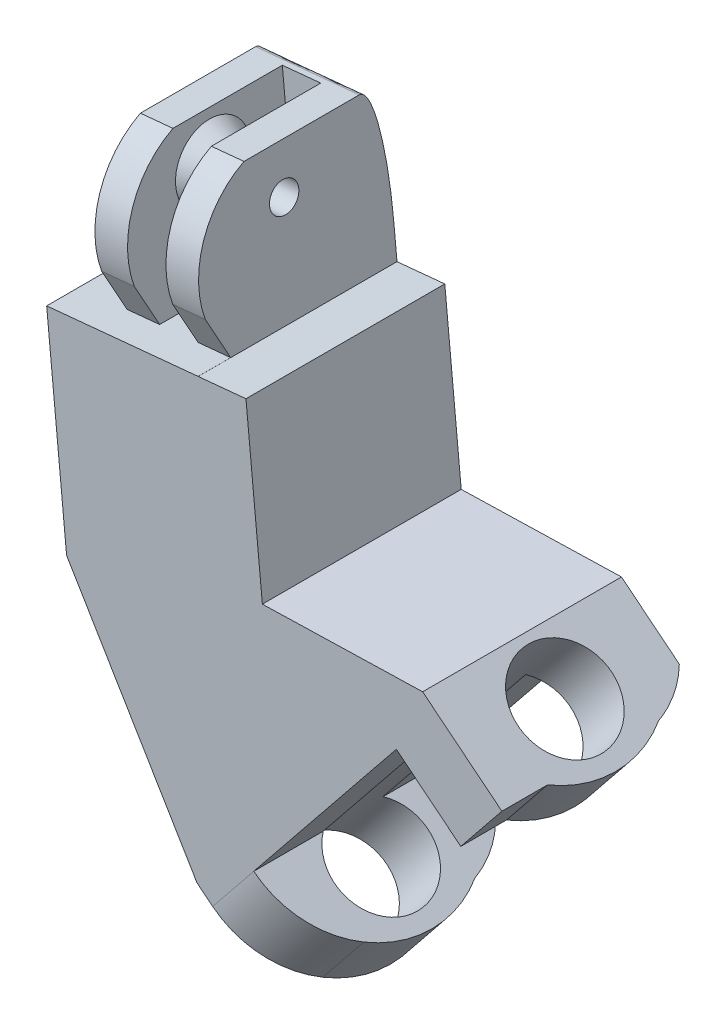
from build123d import *

# Parameters (mm, degrees)
BOSS_EXTRUDE1_DEPTH     = 17
CUT_EXTRUDE1_DEPTH      = 15
CUT_EXTRUDE2_DEPTH      = 46.197309304
CUT_EXTRUDE2_DEPTH_BACK = 46.197309304
CUT_EXTRUDE3_DEPTH      = 12
SKETCH6_R               = 4
CUT_EXTRUDE4_DEPTH      = 35
CUT_EXTRUDE5_START      = -12.78511231
CUT_EXTRUDE5_OUTLINE_W  = 3.3
CUT_EXTRUDE5_OUTLINE_H  = 13.870481222
CUT_EXTRUDE5_DEPTH      = 12.78511231
SKETCH8_R               = 1.25
CUT_EXTRUDE6_DEPTH      = 15
SKETCH10_R              = 1.25
CUT_EXTRUDE7_DEPTH      = 15
FILLET1_SIZE            = 2
FILLET1_SIZE_2          = 10


# Read off the part's stored shape, not the designer's step: Cut-Extrude5, Extrude-Thin1
with BuildPart() as part:
    # Sketch1 → Boss-Extrude1 (new body)
    with BuildSketch(Plane.XY):
        Polygon((-9.564728379, 17.62000192), (-5.473819301, 18.015682238), (-6.704675095, 30.741407789), (2.153984466, 31.598233783), (3.38531081, 18.867643246), (7.473335954, 19.262913811), (8.876277245, 4.753208867), (22.578615379, 5.119591375), (30.743737203, -1.458779689), (27.230396467, -5.819563663), (20.33101325, -0.260956714), (8.140408694, -15.392023407), (15.036201119, -20.947737373), (11.522860383, -25.308521347), (3.283942394, -18.670695131), (-7.860727511, 0), align=None)
    extrude(amount=BOSS_EXTRUDE1_DEPTH)

    # Sketch3 → Cut-Extrude1 (cut)
    with BuildSketch(Plane(origin=(-3.696725775, -0.357554178, 0), x_dir=(0, 0, 1), z_dir=(-0.9953550068413657, -0.09627258361457379, 0))):
        with BuildLine():
            Line((0, 31.244090554), (0, 32.721435634))
            Line((0, 32.721435634), (17.68, 32.721435634))
            Line((17.68, 32.721435634), (17.68, 18.458978244))
            Line((17.68, 18.458978244), (14.22, 18.458978244))
            Line((14.22, 18.458978244), (16.043166109, 22.04177957))
            ThreePointArc((16.043166109, 22.04177957), (15.680947079, 27.433223117), (11.85, 31.244090554))
            Line((11.85, 31.244090554), (0, 31.244090554))
        make_face()
    extrude(amount=-CUT_EXTRUDE1_DEPTH, mode=Mode.SUBTRACT)

    # Sketch4 → Cut-Extrude2 (cut, two sides: drawn at the far end of the back side and taken through both)
    with BuildSketch(Plane(origin=(7.87496966, 9.774469394, 0), x_dir=(0.7787114240648987, -0.6273822742402098, 0), z_dir=(-0.6273822742402096, -0.7787114240648986, 0)).offset(-CUT_EXTRUDE2_DEPTH_BACK)):
        Polygon((15.990906633, 19.904885529), (15.990906633, 16.999999998), (15.995711897, 16.999999998), (23.069210216, 16.999999998), (24.855711897, 17), (24.855711897, 0), (20.721010741, 0), (15.995711897, -2e-09), (15.990906633, -2e-09), (15.990906633, -2.308790515), (29.141254547, -2.308790515), (29.141254547, 19.904885529), align=None)
        with BuildLine():
            Line((24.855711897, 17), (23.069210216, 17))
            Line((23.069210216, 16.999999998), (23.069210216, 13.096000073))
            ThreePointArc((23.069210216, 13.096000073), (24.441573822, 8.347001118), (23.069216362, 3.598000386))
            add(Edge.make_bspline(
                [(20.721010741, -2e-09), (22.390075827, 1.367964254), (23.069216362, 3.598000386)],
                knots=[0, 0, 0, 1, 1, 1], degree=2))
            Line((20.721010741, 0), (24.855711897, 0))
            Line((24.855711897, 0), (24.855711897, 17))
        make_face()
    extrude(amount=CUT_EXTRUDE2_DEPTH + CUT_EXTRUDE2_DEPTH_BACK, mode=Mode.SUBTRACT)

    # Sketch5 → Cut-Extrude3 (cut)
    with BuildSketch(Plane(origin=(-4.315634896, -5.356597299, 0), x_dir=(0.7787114240649037, -0.6273822742402033, 0), z_dir=(0.6273822742402033, 0.7787114240649037, 0))):
        with BuildLine():
            Line((15.990245326, -16.999999999), (23.069210216, -16.999999999))
            Line((23.069210216, -16.999999999), (23.069210216, -13.096000073))
            ThreePointArc((23.069210216, -13.096000073), (20.032304179, -15.959301473), (15.990245326, -16.999999999))
        make_face()
    extrude(amount=-CUT_EXTRUDE3_DEPTH, mode=Mode.SUBTRACT)

    # Sketch6 → Cut-Extrude4 (cut)
    with BuildSketch(Plane(origin=(11.388310395, 14.135253369, 0), x_dir=(0.7787114240649039, -0.6273822742402033, 0), z_dir=(0.6273822742402032, 0.7787114240649039, 0))):
        with Locations(Location((19.069210216, -8.499999999, 0), (0, 0, 180))):
            Circle(SKETCH6_R)
    extrude(amount=-CUT_EXTRUDE4_DEPTH, mode=Mode.SUBTRACT)

    # Cut-Extrude5 outline → Cut-Extrude5 (cut)
    with BuildSketch(Plane(origin=(-3.00794932, 31.098961967, 0), x_dir=(0.995355006841366, 0.0962725836145697, 0), z_dir=(-0.0962725836145697, 0.995355006841366, 0)).offset(CUT_EXTRUDE5_START)):
        with Locations((0.736022827, -9.435240611)):
            Rectangle(CUT_EXTRUDE5_OUTLINE_W, CUT_EXTRUDE5_OUTLINE_H)
    extrude(amount=CUT_EXTRUDE5_DEPTH, mode=Mode.SUBTRACT)

    # Sketch8 → Cut-Extrude6 (cut)
    with BuildSketch(Plane(origin=(5.161933786, 0.499271816, 0), x_dir=(0, 0, -1), z_dir=(0.9953550068413664, 0.09627258361456668, 0))):
        with Locations(Location((-8.8, 27.244090554, 0), (0, 0, 90))):
            Circle(SKETCH8_R)
    extrude(amount=-CUT_EXTRUDE6_DEPTH, mode=Mode.SUBTRACT)

    # Extrude-Thin1 outline → Extrude-Thin1 (revolve)
    with BuildSketch(Plane(origin=(-2.622858986, 27.11754194, 8.8), x_dir=(-0.0962725836145697, 0.9953550068413659, 0), z_dir=(0, 0, -1))):
        Polygon((1.25, 0.736022827), (0.297372056, -0.913977173), (3.202627944, -0.913977173), (2.25, 0.736022827), (3.202627944, 2.386022827), (0.297372056, 2.386022827), align=None)
    revolve(axis=Axis((-2.622858986, 27.11754194, 8.8), (0.9953550068413659, 0.0962725836145697, 0)))

    # Sketch10 → Cut-Extrude7 (cut)
    with BuildSketch(Plane(origin=(5.161933786, 0.499271816, 0), x_dir=(0, 0, -1), z_dir=(0.9953550068413664, 0.09627258361456668, 0))):
        with Locations(Location((-8.8, 27.244090554, 0), (0, 0, 90))):
            Circle(SKETCH10_R)
    extrude(amount=-CUT_EXTRUDE7_DEPTH, mode=Mode.SUBTRACT)

    # Fillet1
    # an asymmetric fillet: 10, 2 mm, written as the material it takes off along each edge
    with BuildSketch(Plane(origin=(-31.588550266, 28.334593199, 0), x_dir=(0, 0, 1), z_dir=(0.995355006841366, 0.0962725836145696, 0))) as fillet1_piece_1:
        with BuildLine():
            Bezier((FILLET1_SIZE, 0), (0, 0), (0, FILLET1_SIZE_2), weights=[1, 0.707106781, 1])
            Line((0, FILLET1_SIZE_2), (0, 0))
            Line((0, 0), (FILLET1_SIZE, 0))
        make_face()
    extrude(amount=58.9, mode=Mode.SUBTRACT)


solid = part.part
